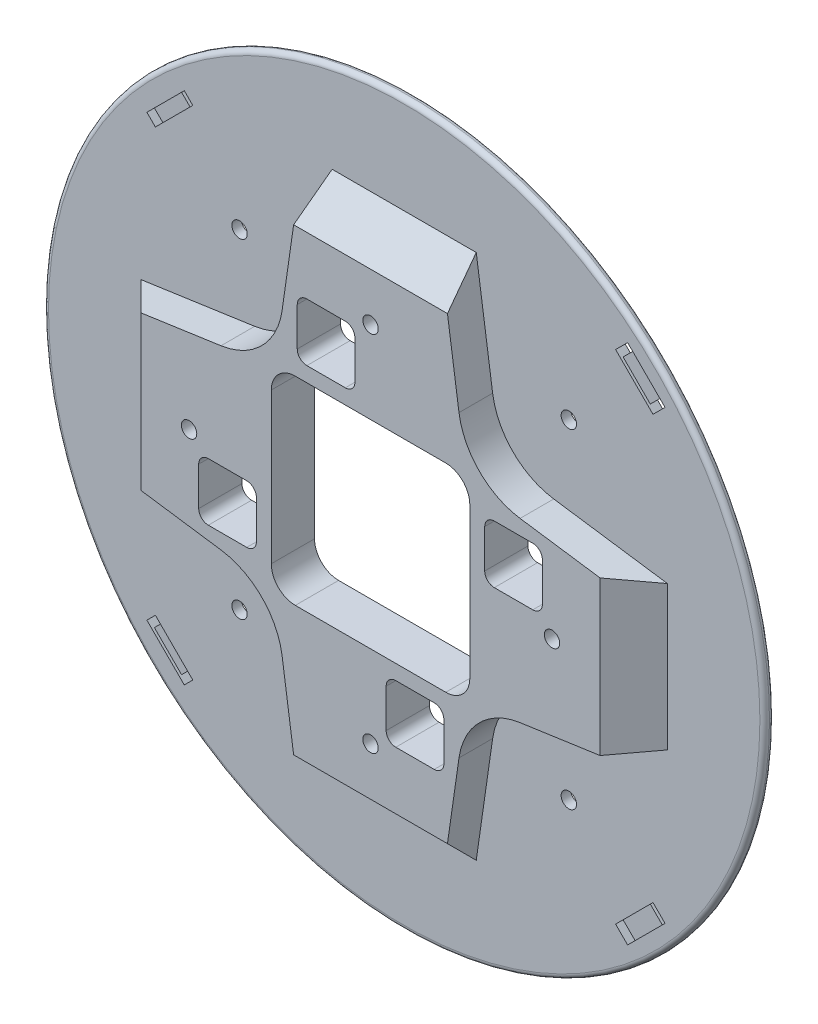
from build123d import *

# Parameters (mm, degrees)
SKETCH_1_W          = 95.5
SKETCH_1_H          = 95.5
EXTRUDE_1_DEPTH     = 7
CUT_EXTRUDE_1_DEPTH = 68.890536896
FILLET_2_R          = 15
SKETCH_3_R          = 75
EXTRUDE_2_DEPTH     = 2
CHAMFER_1_SIZE      = 7
FILLET_1_R          = 1
SKETCH_5_R          = 1.6
CUT_EXTRUDE_2_DEPTH = 107.296754489
SKETCH_6_W          = 42
SKETCH_6_H          = 42
CUT_EXTRUDE_3_DEPTH = 107.447170066
SKETCH_7_R          = 1.6
CUT_EXTRUDE_4_DEPTH = 107.447170066
CUT_EXTRUDE_5_DEPTH = 107.447170066
CUT_EXTRUDE_6_DEPTH = 0.5
SKETCH_10_W         = 12
SKETCH_10_H         = 12
CUT_EXTRUDE_7_DEPTH = 107.447170066
SKETCH_11_W         = 42
SKETCH_11_H         = 42
EXTRUDE_4_DEPTH     = 9
FILLET_3_R          = 2
SKETCH_12_W         = 41.3
SKETCH_12_H         = 41.3
CUT_EXTRUDE_8_DEPTH = 107.447170066
FILLET_4_R          = 5
SKETCH_13_R         = 3.25
CUT_EXTRUDE_9_DEPTH = 2


with BuildPart() as part:
    # ｽｹｯﾁ1 → ﾎﾞｽ - 押し出し1 (new body)
    with BuildSketch(Plane.XY):
        Rectangle(SKETCH_1_W, SKETCH_1_H)
    extrude(amount=EXTRUDE_1_DEPTH)

    # ｽｹｯﾁ2 → ｶｯﾄ - 押し出し1 (cut, through all)
    with BuildSketch(Plane.XY.offset(7)):
        Polygon((-16, 47.75), (-20, 20), (-47.75, 16), (-47.75, 47.75), align=None)
        Polygon((-16, -47.75), (-20, -20), (-47.75, -16), (-47.75, -47.75), align=None)
    cut_extrude_1 = extrude(amount=-CUT_EXTRUDE_1_DEPTH, mode=Mode.SUBTRACT)

    # ﾐﾗｰ1: ｶｯﾄ - 押し出し1 across plane
    add(cut_extrude_1.mirror(Plane(origin=(0, 0, 0), x_dir=(0, 0, 1), z_dir=(1, 0, 0))), mode=Mode.SUBTRACT)

    # ﾌｨﾚｯﾄ2
    fillet_2_edges = [part.edges().sort_by_distance(p)[0] for p in [
        (-20, 20, 3.5),
        (-20, -20, 3.5),
        (20, 20, 3.5),
        (20, -20, 3.5),
    ]]
    fillet(fillet_2_edges, radius=FILLET_2_R)

    # ｽｹｯﾁ3 → ﾎﾞｽ - 押し出し2 (add)
    with BuildSketch(Plane(origin=(0, 0, 0), x_dir=(-1, 0, 0), z_dir=(0, 0, -1))):
        Circle(SKETCH_3_R)
    extrude(amount=EXTRUDE_2_DEPTH)

    # 面取り1
    chamfer_1_edges = [part.edges().sort_by_distance(p)[0] for p in [
        (0, 47.75, 0),
        (47.75, 0, 0),
        (0, -47.75, 0),
        (-47.75, 0, 0),
    ]]
    chamfer(chamfer_1_edges, length=CHAMFER_1_SIZE - 0.0001)  # a hair under: the kernel refuses the full size

    # ﾌｨﾚｯﾄ1
    fillet_1_edges = [part.edges().sort_by_distance(p)[0] for p in [
        (75, 0, 0),
        (75, 0, -2),
    ]]
    fillet(fillet_1_edges, radius=FILLET_1_R - 0.0001)  # a hair under: the kernel refuses the full size

    # ｽｹｯﾁ5 → ｶｯﾄ - 押し出し2 (cut, through all)
    with BuildSketch(Plane.XY):
        with Locations((-34.25, 34.25)):
            Circle(SKETCH_5_R)
        with Locations((34.25, 34.25)):
            Circle(SKETCH_5_R)
        with Locations((34.25, -34.25)):
            Circle(SKETCH_5_R)
        with Locations((-34.25, -34.25)):
            Circle(SKETCH_5_R)
    extrude(amount=-CUT_EXTRUDE_2_DEPTH, mode=Mode.SUBTRACT)

    # ｽｹｯﾁ6 → ｶｯﾄ - 押し出し3 (cut, through all)
    with BuildSketch(Plane.XY.offset(7)):
        Rectangle(SKETCH_6_W, SKETCH_6_H)
    extrude(amount=-CUT_EXTRUDE_3_DEPTH, mode=Mode.SUBTRACT)

    # ｽｹｯﾁ7 → ｶｯﾄ - 押し出し4 (cut, through all)
    with BuildSketch(Plane.XY.offset(7)):
        with Locations((0, 37.75)):
            Circle(SKETCH_7_R)
        with Locations((-37.75, 0)):
            Circle(SKETCH_7_R)
        with Locations((37.75, 0)):
            Circle(SKETCH_7_R)
        with Locations((0, -37.75)):
            Circle(SKETCH_7_R)
    extrude(amount=-CUT_EXTRUDE_4_DEPTH, mode=Mode.SUBTRACT)

    # ｽｹｯﾁ8 → ｶｯﾄ - 押し出し5 (cut, through all)
    with BuildSketch(Plane(origin=(0, 0, -2), x_dir=(-1, 0, 0), z_dir=(0, 0, -1))):
        Polygon((-47.54163056, 53.19848481), (-45.04163056, 50.69848481), (-43.980970389, 51.759144982), (-46.480970389, 54.259144982), align=None)
        Polygon((-53.19848481, 47.54163056), (-54.259144982, 46.480970389), (-51.759144982, 43.980970389), (-50.69848481, 45.04163056), align=None)
        Polygon((45.748737342, 53.526911935), (43.980970389, 51.759144982), (45.04163056, 50.69848481), (46.809397513, 52.466251763), align=None)
        Polygon((52.466251763, 46.809397513), (50.69848481, 45.04163056), (51.759144982, 43.980970389), (53.526911935, 45.748737342), align=None)
    cut_extrude_5 = extrude(amount=-CUT_EXTRUDE_5_DEPTH, mode=Mode.SUBTRACT)

    # ｽｹｯﾁ9 → ｶｯﾄ - 押し出し6 (cut)
    with BuildSketch(Plane.XY):
        Polygon((-53.526911935, 45.748737342), (-45.748737342, 53.526911935), (-43.980970389, 51.759144982), (-51.759144982, 43.980970389), align=None)
        Polygon((46.480970389, 54.259144982), (43.980970389, 51.759144982), (51.759144982, 43.980970389), (54.259144982, 46.480970389), align=None)
    cut_extrude_6 = extrude(amount=-CUT_EXTRUDE_6_DEPTH, mode=Mode.SUBTRACT)

    # ﾐﾗｰ2: ｶｯﾄ - 押し出し5, ｶｯﾄ - 押し出し6 across plane
    add(cut_extrude_5.mirror(Plane.ZX), mode=Mode.SUBTRACT)
    add(cut_extrude_6.mirror(Plane.ZX), mode=Mode.SUBTRACT)

    # ｽｹｯﾁ10 → ｶｯﾄ - 押し出し7 (cut, through all)
    with BuildSketch(Plane.XY.offset(7)):
        with Locations((-29.75, -9.25)):
            Rectangle(SKETCH_10_W, SKETCH_10_H)
        with Locations((-9.25, 29.75)):
            Rectangle(SKETCH_10_W, SKETCH_10_H)
        with Locations((29.75, 9.25)):
            Rectangle(SKETCH_10_W, SKETCH_10_H)
        with Locations((9.25, -29.75)):
            Rectangle(SKETCH_10_W, SKETCH_10_H)
    extrude(amount=-CUT_EXTRUDE_7_DEPTH, mode=Mode.SUBTRACT)

    # ｽｹｯﾁ11 → ﾎﾞｽ - 押し出し4 (add, through all)
    with BuildSketch(Plane(origin=(0, 0, -2), x_dir=(-1, 0, 0), z_dir=(0, 0, -1))):
        Rectangle(SKETCH_11_W, SKETCH_11_H)
    extrude(amount=-EXTRUDE_4_DEPTH)

    # ﾌｨﾚｯﾄ3
    fillet_3_edges = [part.edges().sort_by_distance(p)[0] for p in [
        (-35.75, -15.25, 2.5),
        (-35.75, -3.25, 2.5),
        (-23.75, -3.25, 2.5),
        (-23.75, -15.25, 2.5),
        (-15.25, 23.75, 2.5),
        (-15.25, 35.75, 2.5),
        (-3.25, 35.75, 2.5),
        (-3.25, 23.75, 2.5),
        (23.75, 3.25, 2.5),
        (23.75, 15.25, 2.5),
        (35.75, 15.25, 2.5),
        (35.75, 3.25, 2.5),
        (15.25, -23.75, 2.5),
        (15.25, -35.75, 2.5),
        (3.25, -35.75, 2.5),
        (3.25, -23.75, 2.5),
    ]]
    fillet(fillet_3_edges, radius=FILLET_3_R)

    # ｽｹｯﾁ12 → ｶｯﾄ - 押し出し8 (cut, through all)
    with BuildSketch(Plane.XY.offset(7)):
        Rectangle(SKETCH_12_W, SKETCH_12_H)
    extrude(amount=-CUT_EXTRUDE_8_DEPTH, mode=Mode.SUBTRACT)

    # ﾌｨﾚｯﾄ4
    fillet_4_edges = [part.edges().sort_by_distance(p)[0] for p in [
        (-20.65, -20.65, 2.5),
        (-20.65, 20.65, 2.5),
        (20.65, 20.65, 2.5),
        (20.65, -20.65, 2.5),
    ]]
    fillet(fillet_4_edges, radius=FILLET_4_R)

    # ｽｹｯﾁ13 → ｶｯﾄ - 押し出し9 (cut)
    with BuildSketch(Plane(origin=(0, 0, -2), x_dir=(-1, 0, 0), z_dir=(0, 0, -1))):
        with Locations((-37.75, 0)):
            Circle(SKETCH_13_R)
        with Locations((0, -37.75)):
            Circle(SKETCH_13_R)
        with Locations((37.75, 0)):
            Circle(SKETCH_13_R)
        with Locations((0, 37.75)):
            Circle(SKETCH_13_R)
    extrude(amount=-CUT_EXTRUDE_9_DEPTH, mode=Mode.SUBTRACT)


solid = part.part
